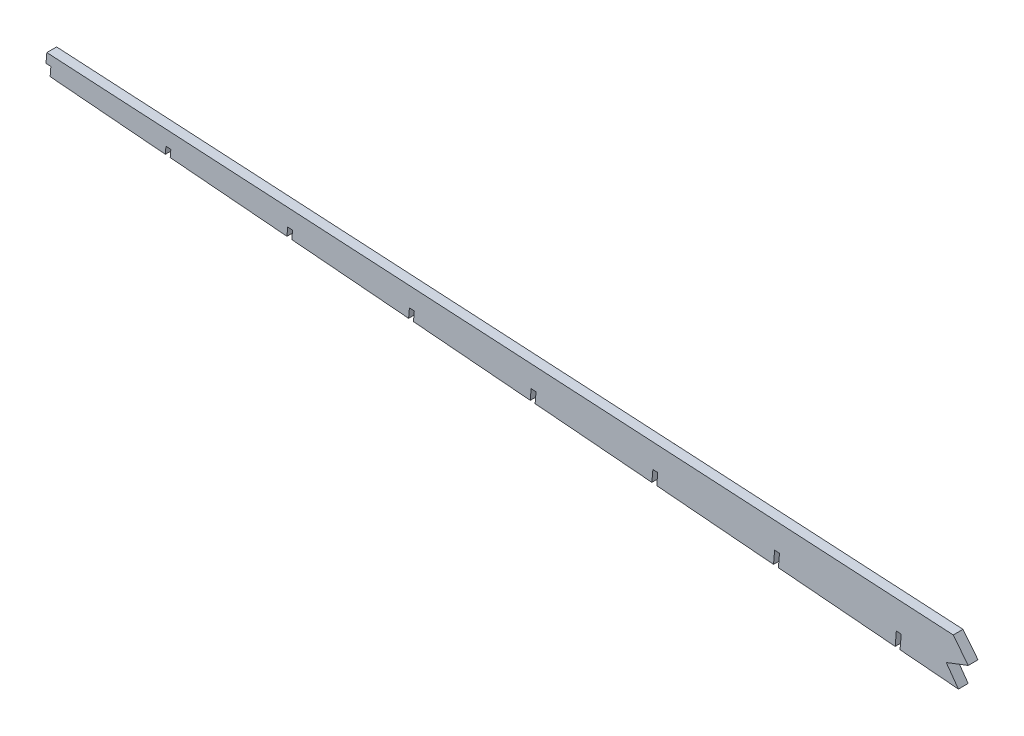
from build123d import *

# Parameters (mm, degrees)
BOSS_EXTRUDE1_DEPTH = 3.175
CUT_EXTRUDE1_DEPTH  = 955.556499367
CUT_EXTRUDE2_DEPTH  = 7.62


with BuildPart() as part:
    # Sketch1 → Boss-Extrude1 (new, symmetric)
    with BuildSketch(Plane.XY):
        Polygon((76.2, 37.697541537), (76.2, 56.747541537), (79.375, 56.747541537), (79.375, 37.697541537), (92.075, 37.697541537), (92.075, 46.587541537), (95.25, 46.587541537), (95.25, 37.697541537), (136.525, 37.697541537), (136.525, 46.587541537), (139.7, 46.587541537), (139.7, 37.697541537), (152.4, 37.697541537), (152.4, 69.447541537), (0, 69.447541537), (-0.423998633, 69.491926731), (-3.587863461, 69.757603883), (-946.051908629, 122.953392794), (-946.583462345, 116.623288424), (-943.412318182, 116.444298555), (-943.91275138, 110.48479854), (-6.775989292, 31.791225946), (-5.713280681, 44.446685258), (-2.549415853, 44.181008106), (-3.612124464, 31.525548794), (-1.492292584, 31.347541537), (0, 31.347541537), (0, 44.047541537), (3.175, 44.047541537), (3.175, 31.347541537), (15.875, 31.347541537), (15.875, 36.427541537), (19.05, 36.427541537), (19.05, 31.347541537), (25.4, 31.347541537), (69.85, 37.697541537), align=None)
    extrude(amount=BOSS_EXTRUDE1_DEPTH, both=True)

    # Sketch2 → Cut-Extrude1 (cut, through all)
    with BuildSketch(Plane.XY.offset(3.175)):
        Polygon((-76.254460917, 37.625496217), (-75.245037036, 49.646404609), (-78.411328309, 49.883186), (-79.418325745, 37.891173369), align=None)
        Polygon((-155.224527027, 44.256797945), (-154.27566721, 55.556468134), (-157.441958483, 55.793249525), (-158.388391855, 44.522475098), align=None)
        Polygon((-234.194593137, 50.888099674), (-233.306297384, 61.466531659), (-236.472588657, 61.70331305), (-237.358457965, 51.153776826), align=None)
        Polygon((-313.164659247, 57.519401402), (-312.336927558, 67.376595183), (-315.503218831, 67.613376574), (-316.328524075, 57.785078555), align=None)
        Polygon((-392.134725356, 64.15070313), (-391.367557732, 73.286658708), (-394.533849005, 73.523440099), (-395.298590185, 64.416380283), align=None)
        Polygon((-471.104791466, 70.782004859), (-470.398187906, 79.196722233), (-473.564479179, 79.433503624), (-474.268656294, 71.047682011), align=None)
        Polygon((-550.074857576, 77.413306587), (-549.42881808, 85.106785757), (-552.595109353, 85.343567149), (-553.238722404, 77.67898374), align=None)
        Polygon((-629.044923686, 84.044608316), (-628.459448254, 91.016849282), (-631.625739527, 91.253630673), (-632.208788514, 84.310285468), align=None)
        Polygon((-708.014989796, 90.675910044), (-707.490078428, 96.926912807), (-710.656369701, 97.163694198), (-711.178854624, 90.941587197), align=None)
        Polygon((-786.985055905, 97.307211772), (-786.520708602, 102.836976331), (-789.686999875, 103.073757723), (-790.148920734, 97.572888925), align=None)
        Polygon((-865.955122015, 103.938513501), (-865.551338776, 108.747039856), (-868.717630049, 108.983821247), (-869.118986843, 104.204190653), align=None)
    extrude(amount=-CUT_EXTRUDE1_DEPTH, mode=Mode.SUBTRACT)

    # Sketch3 → Cut-Extrude2 (cut)
    with BuildSketch(Plane.XY.offset(3.175)):
        Polygon((-354.231624716, 60.967890842), (-362.126685184, 71.979397876), (-347.872352174, 77.449083798), (-357.599036746, 89.739165772), (194.218411841, 89.739165772), (127.81181163, -85.755982461), align=None)
    extrude(amount=-CUT_EXTRUDE2_DEPTH, mode=Mode.SUBTRACT)


solid = part.part
